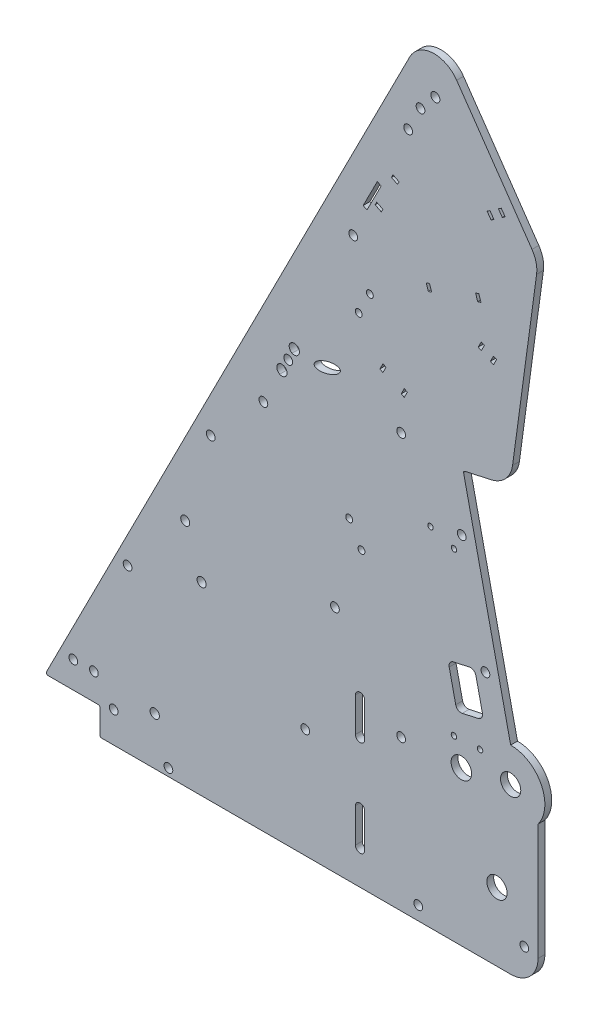
from build123d import *

# Parameters (mm, degrees)
BOSS_EXTRUDE1_DEPTH     = 3.175
SKETCH2_R               = 2.0955
SKETCH2_R_2             = 2.032
SKETCH2_R_3             = 4.699
CUT_EXTRUDE1_DEPTH      = 421.976111717
SKETCH7_R               = 2.159
SKETCH7_R_2             = 2.032
CUT_EXTRUDE2_DEPTH      = 421.976111717
CUT_EXTRUDE3_REACH      = 422.976
SKETCH10_R              = 2.032
FILLET1_R               = 12.7
FILLET2_R               = 0.79375
SKETCH12_R              = 2.032
CUT_EXTRUDE5_DEPTH      = 411.989226146
CUT_EXTRUDE6_DEPTH      = 411.989226146
CUT_EXTRUDE6_DEPTH_BACK = 411.989226146
SKETCH13_R              = 1.27
CUT_EXTRUDE7_REACH      = 412.989
SKETCH14_R              = 2.032
SKETCH14_R_2            = 1.6
SKETCH14_RX             = 6.35
SKETCH14_RY             = 2.38125
SKETCH15_R              = 2.032
CUT_EXTRUDE8_DEPTH      = 411.989226285
FILLET3_R               = 2.54
SKETCH16_R              = 4.7625
CUT_EXTRUDE9_DEPTH      = 411.989226285


with BuildPart() as part:
    # Sketch1 → Boss-Extrude1 (new body)
    with BuildSketch(Plane.XY):
        with BuildLine():
            Line((228.6, -12.7), (228.6, 53.975))
            ThreePointArc((228.6, 53.975), (230.099031657, 70.599515829), (215.9, 79.375))
            Line((215.9, 79.375), (193.909735224, 178.566674323))
            Line((193.909735224, 178.566674323), (215.607913982, 183.377044743))
            Line((215.607913982, 183.377044743), (228.6, 279.4))
            Line((228.6, 279.4), (178.754725958, 351.413083686))
            Line((178.754725958, 351.413083686), (0, 0))
            Line((0, 0), (25.4, 0))
            Line((25.4, 0), (25.4, -12.7))
            Line((25.4, -12.7), (228.6, -12.7))
        make_face()
    extrude(amount=BOSS_EXTRUDE1_DEPTH)

    # Sketch2 → Cut-Extrude1 (cut, through all)
    with BuildSketch(Plane.XY.offset(3.175)):
        with Locations((64.943150167, 94.057839899)):
            Circle(SKETCH2_R)
        with Locations((180.975, 322.164313376)):
            Circle(SKETCH2_R)
        with Locations((72.544547852, 73.173171402)):
            Circle(SKETCH2_R)
        with Locations((193.207821773, 152.394364194)):
            Circle(SKETCH2_R_2)
        with Locations((215.9, 63.5)):
            Circle(SKETCH2_R_3)
        with Locations((173.0375, -6.35)):
            Circle(SKETCH2_R_2)
        with Locations((204.202954161, 102.798527032)):
            Circle(SKETCH2_R_2)
        with Locations((209.55, 19.05)):
            Circle(SKETCH2_R_3)
        with Locations((165.1, 179.3875)):
            Circle(SKETCH2_R_2)
    extrude(amount=-CUT_EXTRUDE1_DEPTH, mode=Mode.SUBTRACT)

    # Sketch7 → Cut-Extrude2 (cut, through all)
    with BuildSketch(Plane.XY.offset(3.175)):
        with Locations((50.8, 9.525)):
            Circle(SKETCH7_R)
        with Locations((134.393547852, 93.98)):
            Circle(SKETCH7_R_2)
        with BuildLine():
            Line((143.891, 3.175), (143.891, 19.05))
            ThreePointArc((143.891, 19.05), (146.05, 21.209), (148.209, 19.05))
            Line((148.209, 19.05), (148.209, 3.175))
            ThreePointArc((148.209, 3.175), (146.05, 1.016), (143.891, 3.175))
        make_face()
        with BuildLine():
            Line((143.891, 47.625), (143.891, 63.5))
            ThreePointArc((143.891, 63.5), (146.05, 65.659), (148.209, 63.5))
            Line((148.209, 63.5), (148.209, 47.625))
            ThreePointArc((148.209, 47.625), (146.05, 45.466), (143.891, 47.625))
        make_face()
    extrude(amount=-CUT_EXTRUDE2_DEPTH, mode=Mode.SUBTRACT)

    # Sketch10 → Cut-Extrude3 (cut, up to next)
    with BuildSketch(Plane.XY.offset(3.175), mode=Mode.PRIVATE) as cut_extrude3_sk1:
        with Locations((165.1, 57.15)):
            Circle(SKETCH10_R)
    cut_extrude3_tool1 = extrude(cut_extrude3_sk1.sketch, amount=-CUT_EXTRUDE3_REACH, mode=Mode.PRIVATE) & part.part
    # Sketch10 → Cut-Extrude3 (cut, up to next)
    with BuildSketch(Plane.XY.offset(3.175), mode=Mode.PRIVATE) as cut_extrude3_sk2:
        with Locations((120.65, 38.1)):
            Circle(SKETCH10_R)
    cut_extrude3_tool2 = extrude(cut_extrude3_sk2.sketch, amount=-CUT_EXTRUDE3_REACH, mode=Mode.PRIVATE) & part.part
    # Sketch10 → Cut-Extrude3 (cut, up to next)
    with BuildSketch(Plane.XY.offset(3.175), mode=Mode.PRIVATE) as cut_extrude3_sk3:
        with Locations((13.046467246, 12.334704411)):
            Circle(SKETCH10_R)
    cut_extrude3_tool3 = extrude(cut_extrude3_sk3.sketch, amount=-CUT_EXTRUDE3_REACH, mode=Mode.PRIVATE) & part.part
    # Sketch10 → Cut-Extrude3 (cut, up to next)
    with BuildSketch(Plane.XY.offset(3.175), mode=Mode.PRIVATE) as cut_extrude3_sk4:
        with Locations((22.571467246, 12.334704411)):
            Circle(SKETCH10_R)
    cut_extrude3_tool4 = extrude(cut_extrude3_sk4.sketch, amount=-CUT_EXTRUDE3_REACH, mode=Mode.PRIVATE) & part.part
    # Sketch10 → Cut-Extrude3 (cut, up to next)
    with BuildSketch(Plane.XY.offset(3.175), mode=Mode.PRIVATE) as cut_extrude3_sk5:
        with Locations((38.211447917, 62.639810909)):
            Circle(SKETCH10_R)
    cut_extrude3_tool5 = extrude(cut_extrude3_sk5.sketch, amount=-CUT_EXTRUDE3_REACH, mode=Mode.PRIVATE) & part.part
    add(cut_extrude3_tool1.solids().sort_by_distance((165.1, 57.15, 3.175))[0], mode=Mode.SUBTRACT)
    add(cut_extrude3_tool2.solids().sort_by_distance((120.65, 38.1, 3.175))[0], mode=Mode.SUBTRACT)
    add(cut_extrude3_tool3.solids().sort_by_distance((13.046467, 12.334704, 3.175))[0], mode=Mode.SUBTRACT)
    add(cut_extrude3_tool4.solids().sort_by_distance((22.571467, 12.334704, 3.175))[0], mode=Mode.SUBTRACT)
    add(cut_extrude3_tool5.solids().sort_by_distance((38.211448, 62.639811, 3.175))[0], mode=Mode.SUBTRACT)

    # Fillet1
    fillet1_edges = [part.edges().sort_by_distance(p)[0] for p in [
        (228.6, -12.7, 1.5875),
        (178.754725958, 351.413083686, 1.5875),
        (215.607913982, 183.377044743, 1.5875),
        (228.6, 279.4, 1.5875),
    ]]
    fillet(fillet1_edges, radius=FILLET1_R)

    # Fillet2
    fillet2_edges = [part.edges().sort_by_distance(p)[0] for p in [
        (25.4, -12.7, 1.5875),
        (25.4, 0, 1.5875),
        (193.909735224, 178.566674323, 1.5875),
        (0, 0, 1.5875),
    ]]
    fillet(fillet2_edges, radius=FILLET2_R)

    # Sketch12 → Cut-Extrude5 (cut, through all)
    with BuildSketch(Plane.XY.offset(3.175)):
        with Locations((31.75, 1.5875)):
            Circle(SKETCH12_R)
        with Locations((222.25, 1.5875)):
            Circle(SKETCH12_R)
        with Locations((57.15, -9.2075)):
            Circle(SKETCH12_R)
    extrude(amount=-CUT_EXTRUDE5_DEPTH, mode=Mode.SUBTRACT)

    # Sketch13 → Cut-Extrude6 (cut, two sides: drawn at the far end of the back side and taken through both)
    with BuildSketch(Plane.XY.offset(3.175).offset(-CUT_EXTRUDE6_DEPTH_BACK)):
        with Locations((189.602197334, 69.980636704)):
            Circle(SKETCH13_R)
        with Locations((201.708862449, 70.509225118)):
            Circle(SKETCH13_R)
        with Locations((178.721644858, 148.532438598)):
            Circle(SKETCH13_R)
        with Locations((189.622629605, 145.09537131)):
            Circle(SKETCH13_R)
        Polygon((186.844411154, 98.950230697), (199.243370445, 101.699013794), (203.36654509, 83.100574858), (190.9675858, 80.351791761), align=None)
    extrude(amount=CUT_EXTRUDE6_DEPTH + CUT_EXTRUDE6_DEPTH_BACK, mode=Mode.SUBTRACT)

    # Sketch14 → Cut-Extrude7 (cut, up to next)
    with BuildSketch(Plane.XY.offset(3.175), mode=Mode.PRIVATE) as cut_extrude7_sk1:
        with Locations((142.875, 247.65)):
            Circle(SKETCH14_R)
    cut_extrude7_tool1 = extrude(cut_extrude7_sk1.sketch, amount=-CUT_EXTRUDE7_REACH, mode=Mode.PRIVATE) & part.part
    # Sketch14 → Cut-Extrude7 (cut, up to next)
    with BuildSketch(Plane.XY.offset(3.175), mode=Mode.PRIVATE) as cut_extrude7_sk2:
        with Locations((112.7125, 182.5625)):
            Circle(SKETCH14_R)
    cut_extrude7_tool2 = extrude(cut_extrude7_sk2.sketch, amount=-CUT_EXTRUDE7_REACH, mode=Mode.PRIVATE) & part.part
    # Sketch14 → Cut-Extrude7 (cut, up to next)
    with BuildSketch(Plane.XY.offset(3.175), mode=Mode.PRIVATE) as cut_extrude7_sk3:
        with Locations((101.196445848, 159.923142748)):
            Circle(SKETCH14_R)
    cut_extrude7_tool3 = extrude(cut_extrude7_sk3.sketch, amount=-CUT_EXTRUDE7_REACH, mode=Mode.PRIVATE) & part.part
    # Sketch14 → Cut-Extrude7 (cut, up to next)
    with BuildSketch(Plane.XY.offset(3.175), mode=Mode.PRIVATE) as cut_extrude7_sk4:
        with Locations((150.594024053, 227.898538502)):
            Circle(SKETCH14_R_2)
    cut_extrude7_tool4 = extrude(cut_extrude7_sk4.sketch, amount=-CUT_EXTRUDE7_REACH, mode=Mode.PRIVATE) & part.part
    # Sketch14 → Cut-Extrude7 (cut, up to next)
    with BuildSketch(Plane.XY.offset(3.175), mode=Mode.PRIVATE) as cut_extrude7_sk5:
        with Locations((145.425401324, 217.737567137)):
            Circle(SKETCH14_R_2)
    cut_extrude7_tool5 = extrude(cut_extrude7_sk5.sketch, amount=-CUT_EXTRUDE7_REACH, mode=Mode.PRIVATE) & part.part
    # Sketch14 → Cut-Extrude7 (cut, up to next)
    with BuildSketch(Plane.XY.offset(3.175), mode=Mode.PRIVATE) as cut_extrude7_sk6:
        with Locations((141.005822998, 132.980540747)):
            Circle(SKETCH14_R_2)
    cut_extrude7_tool6 = extrude(cut_extrude7_sk6.sketch, amount=-CUT_EXTRUDE7_REACH, mode=Mode.PRIVATE) & part.part
    # Sketch14 → Cut-Extrude7 (cut, up to next)
    with BuildSketch(Plane.XY.offset(3.175), mode=Mode.PRIVATE) as cut_extrude7_sk7:
        with Locations((146.705822998, 123.107851144)):
            Circle(SKETCH14_R_2)
    cut_extrude7_tool7 = extrude(cut_extrude7_sk7.sketch, amount=-CUT_EXTRUDE7_REACH, mode=Mode.PRIVATE) & part.part
    # Sketch14 → Cut-Extrude7 (cut, up to next)
    with BuildSketch(Plane.XY.offset(3.175), mode=Mode.PRIVATE) as cut_extrude7_sk8:
        with Locations(Location((130.826142263, 188.461522288), (0, 0, -161.961260538))):
            Ellipse(SKETCH14_RX, SKETCH14_RY)
    cut_extrude7_tool8 = extrude(cut_extrude7_sk8.sketch, amount=-CUT_EXTRUDE7_REACH, mode=Mode.PRIVATE) & part.part
    # Sketch14 → Cut-Extrude7 (cut, up to next)
    with BuildSketch(Plane.XY.offset(3.175), mode=Mode.PRIVATE) as cut_extrude7_sk9:
        Polygon((147.482742003, 261.9243054), (154.04689287, 274.828739034), (155.829519425, 273.921963116), (149.265368558, 261.017529483), align=None)
    cut_extrude7_tool9 = extrude(cut_extrude7_sk9.sketch, amount=-CUT_EXTRUDE7_REACH, mode=Mode.PRIVATE) & part.part
    # Sketch14 → Cut-Extrude7 (cut, up to next)
    with BuildSketch(Plane.XY.offset(3.175), mode=Mode.PRIVATE) as cut_extrude7_sk10:
        Polygon((160.590482388, 279.78010172), (161.310235773, 281.195061549), (164.140155429, 279.75555478), (163.420402045, 278.340594951), align=None)
    cut_extrude7_tool10 = extrude(cut_extrude7_sk10.sketch, amount=-CUT_EXTRUDE7_REACH, mode=Mode.PRIVATE) & part.part
    # Sketch14 → Cut-Extrude7 (cut, up to next)
    with BuildSketch(Plane.XY.offset(3.175), mode=Mode.PRIVATE) as cut_extrude7_sk11:
        Polygon((153.789663007, 266.410402556), (156.619582664, 264.970895787), (155.899829279, 263.555935959), (153.069909623, 264.995442728), align=None)
    cut_extrude7_tool11 = extrude(cut_extrude7_sk11.sketch, amount=-CUT_EXTRUDE7_REACH, mode=Mode.PRIVATE) & part.part
    # Sketch14 → Cut-Extrude7 (cut, up to next)
    with BuildSketch(Plane.XY.offset(3.175), mode=Mode.PRIVATE) as cut_extrude7_sk12:
        Polygon((178.26972852, 245.992253978), (179.240391581, 242.969268992), (177.728899089, 242.483937462), (176.758236028, 245.506922447), align=None)
    cut_extrude7_tool12 = extrude(cut_extrude7_sk12.sketch, amount=-CUT_EXTRUDE7_REACH, mode=Mode.PRIVATE) & part.part
    # Sketch14 → Cut-Extrude7 (cut, up to next)
    with BuildSketch(Plane.XY.offset(3.175), mode=Mode.PRIVATE) as cut_extrude7_sk13:
        Polygon((200.609634347, 249.830809719), (199.638971286, 252.853794704), (201.150463779, 253.339126235), (202.12112684, 250.316141249), align=None)
    cut_extrude7_tool13 = extrude(cut_extrude7_sk13.sketch, amount=-CUT_EXTRUDE7_REACH, mode=Mode.PRIVATE) & part.part
    # Sketch14 → Cut-Extrude7 (cut, up to next)
    with BuildSketch(Plane.XY.offset(3.175), mode=Mode.PRIVATE) as cut_extrude7_sk14:
        Polygon((156.643043941, 199.39992488), (158.08255071, 202.229844536), (156.667590882, 202.949597921), (155.228084113, 200.119678264), align=None)
    cut_extrude7_tool14 = extrude(cut_extrude7_sk14.sketch, amount=-CUT_EXTRUDE7_REACH, mode=Mode.PRIVATE) & part.part
    # Sketch14 → Cut-Extrude7 (cut, up to next)
    with BuildSketch(Plane.XY.offset(3.175), mode=Mode.PRIVATE) as cut_extrude7_sk15:
        Polygon((165.132802911, 195.081404573), (166.57230968, 197.911324229), (167.987269508, 197.191570845), (166.547762739, 194.361651188), align=None)
    cut_extrude7_tool15 = extrude(cut_extrude7_sk15.sketch, amount=-CUT_EXTRUDE7_REACH, mode=Mode.PRIVATE) & part.part
    # Sketch14 → Cut-Extrude7 (cut, up to next)
    with BuildSketch(Plane.XY.offset(3.175), mode=Mode.PRIVATE) as cut_extrude7_sk16:
        Polygon((202.294473359, 234.556847059), (200.85496659, 231.726927403), (202.269926418, 231.007174018), (203.709433187, 233.837093675), align=None)
    cut_extrude7_tool16 = extrude(cut_extrude7_sk16.sketch, amount=-CUT_EXTRUDE7_REACH, mode=Mode.PRIVATE) & part.part
    # Sketch14 → Cut-Extrude7 (cut, up to next)
    with BuildSketch(Plane.XY.offset(3.175), mode=Mode.PRIVATE) as cut_extrude7_sk17:
        Polygon((206.514805903, 228.847913865), (207.954312672, 231.677833521), (209.3692725, 230.958080137), (207.929765731, 228.12816048), align=None)
    cut_extrude7_tool17 = extrude(cut_extrude7_sk17.sketch, amount=-CUT_EXTRUDE7_REACH, mode=Mode.PRIVATE) & part.part
    # Sketch14 → Cut-Extrude7 (cut, up to next)
    with BuildSketch(Plane.XY.offset(3.175), mode=Mode.PRIVATE) as cut_extrude7_sk18:
        Polygon((205.013971437, 288.371538288), (206.820969573, 285.760909487), (208.126283974, 286.664408555), (206.319285837, 289.275037356), align=None)
    cut_extrude7_tool18 = extrude(cut_extrude7_sk18.sketch, amount=-CUT_EXTRUDE7_REACH, mode=Mode.PRIVATE) & part.part
    # Sketch14 → Cut-Extrude7 (cut, up to next)
    with BuildSketch(Plane.XY.offset(3.175), mode=Mode.PRIVATE) as cut_extrude7_sk19:
        Polygon((210.235229039, 291.98553456), (212.042227175, 289.374905759), (213.347541575, 290.278404827), (211.540543439, 292.889033628), align=None)
    cut_extrude7_tool19 = extrude(cut_extrude7_sk19.sketch, amount=-CUT_EXTRUDE7_REACH, mode=Mode.PRIVATE) & part.part
    # Sketch14 → Cut-Extrude7 (cut, up to next)
    with BuildSketch(Plane.XY.offset(3.175), mode=Mode.PRIVATE) as cut_extrude7_sk20:
        with BuildLine():
            add(Edge.make_bspline(
                [(108.753856385, 174.780220945), (110.821723963, 173.728350313), (111.90135404, 175.850790056), (112.980984117, 177.973229798), (110.913116539, 179.025100429)],
                knots=[0, 0, 0, 1.570796327, 1.570796327, 3.141592654, 3.141592654, 3.141592654], degree=2, weights=[1, 0.707106781, 1, 0.707106781, 1]))
            add(Edge.make_bspline(
                [(110.913116539, 179.025100429), (110.77268373, 179.096534959), (110.626511301, 179.154391231), (110.322493118, 179.242488117), (110.165373026, 179.272144601), (109.695542578, 179.315227584), (109.373415846, 179.283109915), (108.9218002, 179.145618276), (108.77365547, 179.084104344), (108.495402792, 178.934315945), (108.365007933, 178.846412483), (108.121928357, 178.644218756), (108.0096946, 178.529696631), (107.813416216, 178.283892413), (107.727754596, 178.151249117), (107.58342172, 177.86715543), (107.526957985, 177.720181494), (107.444132542, 177.416788403), (107.417775942, 177.25846019), (107.397765558, 176.943245973), (107.403605499, 176.786285249), (107.446503964, 176.473637327), (107.48413539, 176.317513381), (107.58741463, 176.020451076), (107.653173274, 175.877669132), (107.813265642, 175.6037409), (107.906595752, 175.474826714), (108.217757093, 175.120973916), (108.473611136, 174.922774438), (108.753856385, 174.780220945)],
                knots=[0, 0, 0, 0, 0.0625, 0.0625, 0.125, 0.125, 0.25, 0.25, 0.3125, 0.3125, 0.375, 0.375, 0.4375, 0.4375, 0.5, 0.5, 0.5625, 0.5625, 0.625, 0.625, 0.6875, 0.6875, 0.75, 0.75, 0.8125, 0.8125, 0.875, 0.875, 1, 1, 1, 1], degree=3))
        make_face()
    cut_extrude7_tool20 = extrude(cut_extrude7_sk20.sketch, amount=-CUT_EXTRUDE7_REACH, mode=Mode.PRIVATE) & part.part
    # Sketch14 → Cut-Extrude7 (cut, up to next)
    with BuildSketch(Plane.XY.offset(3.175), mode=Mode.PRIVATE) as cut_extrude7_sk21:
        with BuildLine():
            add(Edge.make_bspline(
                [(114.511883461, 186.099899571), (116.579751039, 185.048028939), (117.659381116, 187.170468682), (118.739011193, 189.292908424), (116.671143615, 190.344779055)],
                knots=[0, 0, 0, 1.570796327, 1.570796327, 3.141592654, 3.141592654, 3.141592654], degree=2, weights=[1, 0.707106781, 1, 0.707106781, 1]))
            add(Edge.make_bspline(
                [(114.511883461, 186.099899571), (114.371072576, 186.171526418), (114.235866303, 186.257351722), (113.987547839, 186.450065421), (113.872855617, 186.557654504), (113.558328181, 186.915480737), (113.397407635, 187.190062471), (113.24126374, 187.640077887), (113.204646123, 187.792957095), (113.161785412, 188.104373095), (113.155794463, 188.264784445), (113.176022459, 188.579744294), (113.201753482, 188.734678369), (113.28477823, 189.039401247), (113.342554455, 189.189068059), (113.556262174, 189.609540487), (113.758638915, 189.862727621), (114.121215939, 190.164706401), (114.254157477, 190.254446578), (114.53236698, 190.404090785), (114.677524715, 190.464472802), (114.97978581, 190.556739169), (115.136913319, 190.588175808), (115.449881014, 190.619878989), (115.607376248, 190.620744977), (115.924438129, 190.591785045), (116.079517328, 190.562319108), (116.3815103, 190.475083726), (116.53003913, 190.416555249), (116.671143615, 190.344779055)],
                knots=[0, 0, 0, 0, 0.0625, 0.0625, 0.125, 0.125, 0.25, 0.25, 0.3125, 0.3125, 0.375, 0.375, 0.4375, 0.4375, 0.5, 0.5, 0.625, 0.625, 0.6875, 0.6875, 0.75, 0.75, 0.8125, 0.8125, 0.875, 0.875, 0.9375, 0.9375, 1, 1, 1, 1], degree=3))
        make_face()
    cut_extrude7_tool21 = extrude(cut_extrude7_sk21.sketch, amount=-CUT_EXTRUDE7_REACH, mode=Mode.PRIVATE) & part.part
    add(cut_extrude7_tool1.solids().sort_by_distance((142.875, 247.65, 3.175))[0], mode=Mode.SUBTRACT)
    add(cut_extrude7_tool2.solids().sort_by_distance((112.7125, 182.5625, 3.175))[0], mode=Mode.SUBTRACT)
    add(cut_extrude7_tool3.solids().sort_by_distance((101.196446, 159.923143, 3.175))[0], mode=Mode.SUBTRACT)
    add(cut_extrude7_tool4.solids().sort_by_distance((150.594024, 227.898539, 3.175))[0], mode=Mode.SUBTRACT)
    add(cut_extrude7_tool5.solids().sort_by_distance((145.425401, 217.737567, 3.175))[0], mode=Mode.SUBTRACT)
    add(cut_extrude7_tool6.solids().sort_by_distance((141.005823, 132.980541, 3.175))[0], mode=Mode.SUBTRACT)
    add(cut_extrude7_tool7.solids().sort_by_distance((146.705823, 123.107851, 3.175))[0], mode=Mode.SUBTRACT)
    add(cut_extrude7_tool8.solids().sort_by_distance((130.826142, 188.461522, 3.175))[0], mode=Mode.SUBTRACT)
    add(cut_extrude7_tool9.solids().sort_by_distance((151.656131, 267.923134, 3.175))[0], mode=Mode.SUBTRACT)
    add(cut_extrude7_tool10.solids().sort_by_distance((162.365319, 279.767828, 3.175))[0], mode=Mode.SUBTRACT)
    add(cut_extrude7_tool11.solids().sort_by_distance((154.844746, 264.983169, 3.175))[0], mode=Mode.SUBTRACT)
    add(cut_extrude7_tool12.solids().sort_by_distance((177.999314, 244.238096, 3.175))[0], mode=Mode.SUBTRACT)
    add(cut_extrude7_tool13.solids().sort_by_distance((200.880049, 251.584968, 3.175))[0], mode=Mode.SUBTRACT)
    add(cut_extrude7_tool14.solids().sort_by_distance((156.655317, 201.174761, 3.175))[0], mode=Mode.SUBTRACT)
    add(cut_extrude7_tool15.solids().sort_by_distance((166.560036, 196.136488, 3.175))[0], mode=Mode.SUBTRACT)
    add(cut_extrude7_tool16.solids().sort_by_distance((202.2822, 232.782011, 3.175))[0], mode=Mode.SUBTRACT)
    add(cut_extrude7_tool17.solids().sort_by_distance((207.942039, 229.902997, 3.175))[0], mode=Mode.SUBTRACT)
    add(cut_extrude7_tool18.solids().sort_by_distance((206.570128, 287.517973, 3.175))[0], mode=Mode.SUBTRACT)
    add(cut_extrude7_tool19.solids().sort_by_distance((211.791385, 291.13197, 3.175))[0], mode=Mode.SUBTRACT)
    add(cut_extrude7_tool20.solids().sort_by_distance((109.786671, 176.923449, 3.175))[0], mode=Mode.SUBTRACT)
    add(cut_extrude7_tool21.solids().sort_by_distance((115.54466, 188.243124, 3.175))[0], mode=Mode.SUBTRACT)

    # Sketch15 → Cut-Extrude8 (cut, through all)
    with BuildSketch(Plane.XY.offset(3.175)):
        with Locations((76.786819993, 134.148053636)):
            Circle(SKETCH15_R)
        with Locations((174.09944549, 314.249958888)):
            Circle(SKETCH15_R)
        with Locations((168.341418414, 302.930280262)):
            Circle(SKETCH15_R)
    extrude(amount=-CUT_EXTRUDE8_DEPTH, mode=Mode.SUBTRACT)

    # Fillet3
    fillet3_edges = [part.edges().sort_by_distance(p)[0] for p in [
        (199.243370445, 101.699013794, 1.5875),
        (186.844411154, 98.950230697, 1.5875),
        (190.9675858, 80.351791761, 1.5875),
        (203.36654509, 83.100574858, 1.5875),
    ]]
    fillet(fillet3_edges, radius=FILLET3_R)

    # Sketch16 → Cut-Extrude9 (cut, through all)
    with BuildSketch(Plane.XY.offset(3.175)):
        with Locations((193.04, 58.801)):
            Circle(SKETCH16_R)
    extrude(amount=-CUT_EXTRUDE9_DEPTH, mode=Mode.SUBTRACT)


solid = part.part
